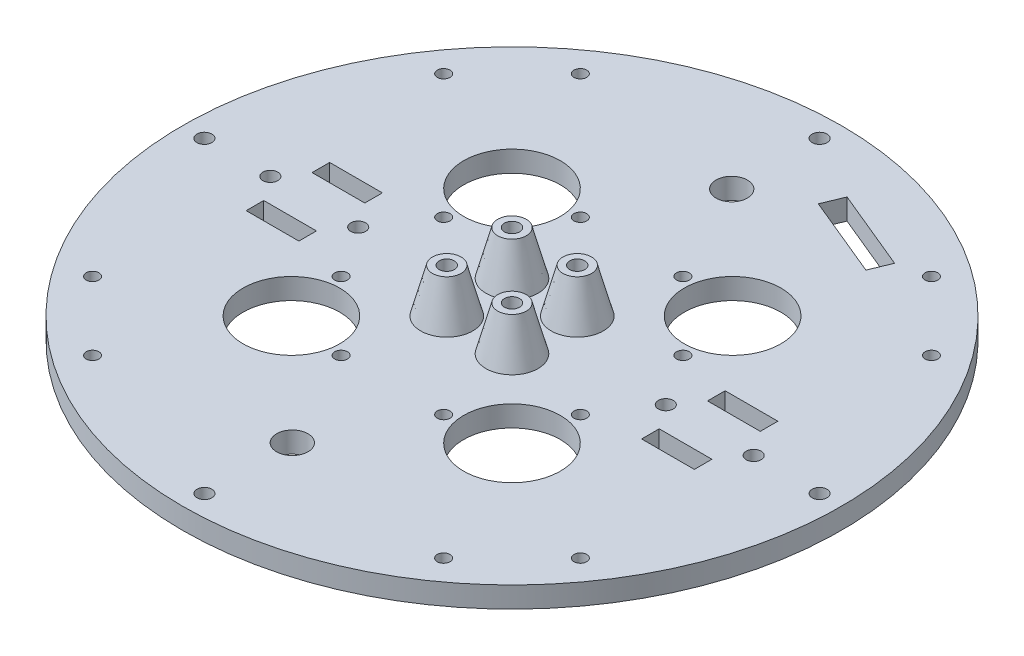
from build123d import *

# Parameters (mm, degrees)
SKETCH1_R           = 75
SKETCH1_R_2         = 11
BOSS_EXTRUDE1_DEPTH = 4.7625
SKETCH2_R           = 1.45
CUT_EXTRUDE1_DEPTH  = 107.172884515
SKETCH4_R           = 3.5687
CUT_EXTRUDE3_DEPTH  = 107.172884515
SKETCH5_R           = 1.7
SKETCH5_W           = 12
SKETCH5_H           = 4
CUT_EXTRUDE4_DEPTH  = 107.172884515
SKETCH6_R           = 1.7
CUT_EXTRUDE5_DEPTH  = 107.172884515
SKETCH7_R           = 3.25
SKETCH7_R_2         = 1.7272
BOSS_EXTRUDE2_DEPTH = 10
CUT_EXTRUDE7_DEPTH  = 108.088427975


# Read off the part's stored shape, not the designer's step: Draft1
with BuildPart() as part:
    # Sketch1 → Boss-Extrude1 (new body)
    with BuildSketch(Plane(origin=(0, 0, 0), x_dir=(1, 0, 0), z_dir=(0, 1, 0))):
        with Locations(Location((0, 0, 0), (0, 0, 90))):
            Circle(SKETCH1_R)
        with Locations(Location((-25.102290732, 25.102290732, 0), (0, 0, 90))):
            Circle(SKETCH1_R_2, mode=Mode.SUBTRACT)
        with Locations(Location((25.102290732, 25.102290732, 0), (0, 0, 90))):
            Circle(SKETCH1_R_2, mode=Mode.SUBTRACT)
        with Locations(Location((25.102290732, -25.102290732, 0), (0, 0, 90))):
            Circle(SKETCH1_R_2, mode=Mode.SUBTRACT)
        with Locations(Location((-25.102290732, -25.102290732, 0), (0, 0, 90))):
            Circle(SKETCH1_R_2, mode=Mode.SUBTRACT)
    extrude(amount=BOSS_EXTRUDE1_DEPTH)

    # Sketch2 → Cut-Extrude1 (cut, through all)
    with BuildSketch(Plane(origin=(0, 4.7625, 0), x_dir=(1, 0, 0), z_dir=(0, 1, 0))):
        with Locations(Location((-39.951533137, 55.507882323, 0), (0, 0, 270))):
            Circle(SKETCH2_R)
        with Locations(Location((-55.507882323, 39.951533137, 0), (0, 0, 270))):
            Circle(SKETCH2_R)
        with Locations(Location((-11.66726189, 27.223611076, 0), (0, 0, 270))):
            Circle(SKETCH2_R)
        with Locations(Location((-27.223611076, 11.66726189, 0), (0, 0, 270))):
            Circle(SKETCH2_R)
        with Locations(Location((-11.66726189, -27.223611076, 0), (0, 0, 270))):
            Circle(SKETCH2_R)
        with Locations(Location((-27.223611076, -11.66726189, 0), (0, 0, 270))):
            Circle(SKETCH2_R)
        with Locations(Location((-55.507882323, -39.951533137, 0), (0, 0, 270))):
            Circle(SKETCH2_R)
        with Locations(Location((-39.951533137, -55.507882323, 0), (0, 0, 270))):
            Circle(SKETCH2_R)
        with Locations(Location((11.66726189, -27.223611076, 0), (0, 0, 270))):
            Circle(SKETCH2_R)
        with Locations(Location((39.951533137, -55.507882323, 0), (0, 0, 270))):
            Circle(SKETCH2_R)
        with Locations(Location((55.507882323, -39.951533137, 0), (0, 0, 270))):
            Circle(SKETCH2_R)
        with Locations(Location((27.223611076, -11.66726189, 0), (0, 0, 270))):
            Circle(SKETCH2_R)
        with Locations(Location((11.66726189, 27.223611076, 0), (0, 0, 270))):
            Circle(SKETCH2_R)
        with Locations(Location((27.223611076, 11.66726189, 0), (0, 0, 270))):
            Circle(SKETCH2_R)
        with Locations(Location((55.507882323, 39.951533137, 0), (0, 0, 270))):
            Circle(SKETCH2_R)
        with Locations(Location((39.951533137, 55.507882323, 0), (0, 0, 270))):
            Circle(SKETCH2_R)
    extrude(amount=-CUT_EXTRUDE1_DEPTH, mode=Mode.SUBTRACT)

    # Sketch4 → Cut-Extrude3 (cut, through all)
    with BuildSketch(Plane(origin=(0, 4.7625, 0), x_dir=(1, 0, 0), z_dir=(0, 1, 0))):
        with Locations(Location((0, -50, 0), (0, 0, 270))):
            Circle(SKETCH4_R)
        with Locations(Location((0, 50, 0), (0, 0, 270))):
            Circle(SKETCH4_R)
    extrude(amount=-CUT_EXTRUDE3_DEPTH, mode=Mode.SUBTRACT)

    # Sketch5 → Cut-Extrude4 (cut, through all)
    with BuildSketch(Plane(origin=(0, 4.7625, 0), x_dir=(1, 0, 0), z_dir=(0, 1, 0))):
        with Locations(Location((55, 0, 0), (0, 0, 270))):
            Circle(SKETCH5_R)
        with Locations(Location((35, 0, 0), (0, 0, 270))):
            Circle(SKETCH5_R)
        with Locations(Location((-55, 0, 0), (0, 0, 270))):
            Circle(SKETCH5_R)
        with Locations(Location((-35, 0, 0), (0, 0, 270))):
            Circle(SKETCH5_R)
        with Locations((45, 7.5)):
            Rectangle(SKETCH5_W, SKETCH5_H)
        with Locations((-45, 7.5)):
            Rectangle(SKETCH5_W, SKETCH5_H)
        with Locations((-45, -7.5)):
            Rectangle(SKETCH5_W, SKETCH5_H)
        with Locations((45, -7.5)):
            Rectangle(SKETCH5_W, SKETCH5_H)
    extrude(amount=-CUT_EXTRUDE4_DEPTH, mode=Mode.SUBTRACT)

    # Sketch6 → Cut-Extrude5 (cut, through all)
    with BuildSketch(Plane.XZ):
        with Locations(Location((0, 70, 0), (0, 0, 270))):
            Circle(SKETCH6_R)
        with Locations(Location((70, 0, 0), (0, 0, 270))):
            Circle(SKETCH6_R)
        with Locations(Location((0, -70, 0), (0, 0, 270))):
            Circle(SKETCH6_R)
        with Locations(Location((-70, 0, 0), (0, 0, 270))):
            Circle(SKETCH6_R)
    extrude(amount=-CUT_EXTRUDE5_DEPTH, mode=Mode.SUBTRACT)

    # Sketch7 → Boss-Extrude2 (add)
    # profile 1 of 4: a face of its own
    with BuildSketch(Plane(origin=(0, 4.7625, 0), x_dir=(1, 0, 0), z_dir=(0, 1, 0))):
        with Locations(Location((7.424621202, 7.424621202, 0), (0, 0, 270))):
            Circle(SKETCH7_R)
        with Locations(Location((7.424621202, 7.424621202, 0), (0, 0, 270))):
            Circle(SKETCH7_R_2, mode=Mode.SUBTRACT)
    # profile 2 of 4: a face of its own
    with BuildSketch(Plane(origin=(0, 4.7625, 0), x_dir=(1, 0, 0), z_dir=(0, 1, 0))):
        with Locations(Location((7.424621202, -7.424621202, 0), (0, 0, 270))):
            Circle(SKETCH7_R)
        with Locations(Location((7.424621202, -7.424621202, 0), (0, 0, 270))):
            Circle(SKETCH7_R_2, mode=Mode.SUBTRACT)
    # profile 3 of 4: a face of its own
    with BuildSketch(Plane(origin=(0, 4.7625, 0), x_dir=(1, 0, 0), z_dir=(0, 1, 0))):
        with Locations(Location((-7.424621202, -7.424621202, 0), (0, 0, 270))):
            Circle(SKETCH7_R)
        with Locations(Location((-7.424621202, -7.424621202, 0), (0, 0, 270))):
            Circle(SKETCH7_R_2, mode=Mode.SUBTRACT)
    # profile 4 of 4: a face of its own
    with BuildSketch(Plane(origin=(0, 4.7625, 0), x_dir=(1, 0, 0), z_dir=(0, 1, 0))):
        with Locations(Location((-7.424621202, 7.424621202, 0), (0, 0, 270))):
            Circle(SKETCH7_R)
        with Locations(Location((-7.424621202, 7.424621202, 0), (0, 0, 270))):
            Circle(SKETCH7_R_2, mode=Mode.SUBTRACT)
    extrude(amount=BOSS_EXTRUDE2_DEPTH)

    # Sketch8 → Cut-Extrude7 (cut, through all)
    with BuildSketch(Plane(origin=(0, 0, 0), x_dir=(1, 0, 0), z_dir=(0, 1, 0))):
        Polygon((12.765502036, 56.949907443), (31.243092686, 49.296238796), (33.156509848, 53.915636458), (14.678919198, 61.569305106), align=None)
    extrude(amount=CUT_EXTRUDE7_DEPTH, mode=Mode.SUBTRACT)

    # Draft1 outline → Draft1 (revolve)
    with BuildSketch(Plane(origin=(7.424621202, 0, -7.424621202), x_dir=(1, 0, 0), z_dir=(0, 0, 1))):
        Polygon((5.929491924, 4.7625), (3.25, 14.7625), (3.25, 4.7625), align=None)
    revolve(axis=Axis((7.424621202, 0, -7.424621202), (0, 1, 0)))

    # Draft1 2 outline → Draft1 2 (revolve)
    with BuildSketch(Plane(origin=(7.424621202, 0, 7.424621202), x_dir=(1, 0, 0), z_dir=(0, 0, 1))):
        Polygon((5.929491924, 4.7625), (3.25, 14.7625), (3.25, 4.7625), align=None)
    revolve(axis=Axis((7.424621202, 0, 7.424621202), (0, 1, 0)))

    # Draft1 3 outline → Draft1 3 (revolve)
    with BuildSketch(Plane(origin=(-7.424621202, 0, 7.424621202), x_dir=(1, 0, 0), z_dir=(0, 0, 1))):
        Polygon((5.929491924, 4.7625), (3.25, 14.7625), (3.25, 4.7625), align=None)
    revolve(axis=Axis((-7.424621202, 0, 7.424621202), (0, 1, 0)))

    # Draft1 4 outline → Draft1 4 (revolve)
    with BuildSketch(Plane(origin=(-7.424621202, 0, -7.424621202), x_dir=(1, 0, 0), z_dir=(0, 0, 1))):
        Polygon((5.929491924, 4.7625), (3.25, 14.7625), (3.25, 4.7625), align=None)
    revolve(axis=Axis((-7.424621202, 0, -7.424621202), (0, 1, 0)))


solid = part.part
